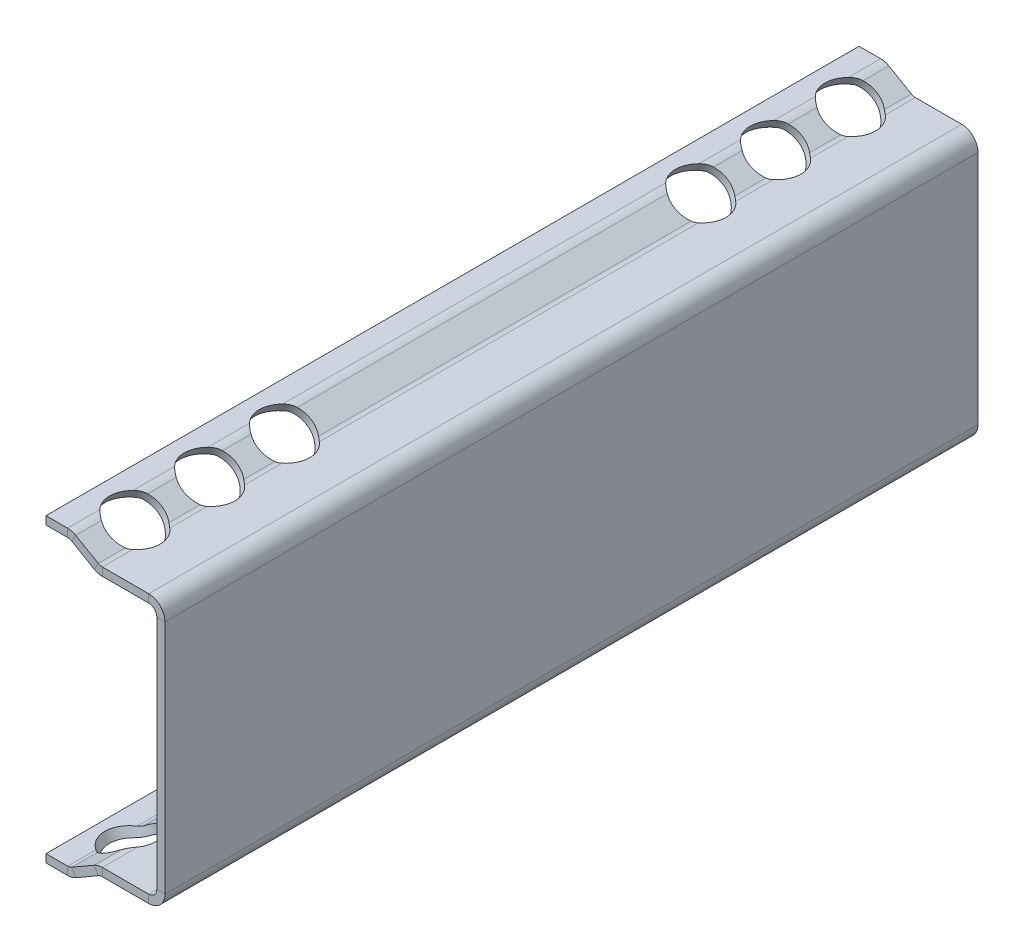
from build123d import *

# Parameters (mm, degrees)
ODGI_CIE_BAZOWE1_DEPTH     = 50
SZKIC6_R                   = 1.6
WYTNIJ_WYCI_GNI_CIE1_DEPTH = 54.108628745


# Sheet-metal steps are written as plain solids
with BuildPart() as part:
    # Szkic1 → Odgięcie bazowe1 (new body)
    with BuildSketch(Plane.XY):
        with BuildLine():
            Line((-7.315765601, -9.25), (-5.983974596, -9.25))
            ThreePointArc((-5.983974596, -9.25), (-5.725155551, -9.215925826), (-5.483974596, -9.116025404))
            Line((-5.483974596, -9.116025404), (-4.1, -8.316987298))
            ThreePointArc((-4.1, -8.316987298), (-3.979409523, -8.267037087), (-3.85, -8.25))
            Line((-3.85, -8.25), (-1, -8.25))
            ThreePointArc((-1, -8.25), (-0.292893219, -7.957106781), (0, -7.25))
            Line((0, -7.25), (0, 7.25))
            ThreePointArc((0, 7.25), (-0.292893219, 7.957106781), (-1, 8.25))
            Line((-1, 8.25), (-3.85, 8.25))
            ThreePointArc((-3.85, 8.25), (-3.979409523, 8.267037087), (-4.1, 8.316987298))
            Line((-4.1, 8.316987298), (-5.483974596, 9.116025404))
            ThreePointArc((-5.483974596, 9.116025404), (-5.725155551, 9.215925826), (-5.983974596, 9.25))
            Line((-5.983974596, 9.25), (-7.315765601, 9.25))
            Line((-7.315765601, 9.25), (-7.315765601, 8.75))
            Line((-7.315765601, 8.75), (-5.983974596, 8.75))
            ThreePointArc((-5.983974596, 8.75), (-5.854565074, 8.732962913), (-5.733974596, 8.683012702))
            Line((-5.733974596, 8.683012702), (-4.35, 7.883974596))
            ThreePointArc((-4.35, 7.883974596), (-4.108819045, 7.784074174), (-3.85, 7.75))
            Line((-3.85, 7.75), (-1, 7.75))
            ThreePointArc((-1, 7.75), (-0.646446609, 7.603553391), (-0.5, 7.25))
            Line((-0.5, 7.25), (-0.5, -7.25))
            ThreePointArc((-0.5, -7.25), (-0.646446609, -7.603553391), (-1, -7.75))
            Line((-1, -7.75), (-3.85, -7.75))
            ThreePointArc((-3.85, -7.75), (-4.108819045, -7.784074174), (-4.35, -7.883974596))
            Line((-4.35, -7.883974596), (-5.733974596, -8.683012702))
            ThreePointArc((-5.733974596, -8.683012702), (-5.854565074, -8.732962913), (-5.983974596, -8.75))
            Line((-5.983974596, -8.75), (-7.315765601, -8.75))
            Line((-7.315765601, -8.75), (-7.315765601, -9.25))
        make_face()
    extrude(amount=-ODGI_CIE_BAZOWE1_DEPTH)

    # Szkic6 → Wytnij-wyciągnięcie1 (cut, through all)
    with BuildSketch(Plane(origin=(3.076361142, 5.3284138, 0), x_dir=(0.8660254037844378, -0.5000000000000017, 0), z_dir=(0.5000000000000016, 0.8660254037844377, 0))):
        with Locations(Location((-8.575223208, 3, 0), (0, 0, 117.227950477))):
            Circle(SZKIC6_R)
        with Locations(Location((-8.575223208, 7.6, 0), (0, 0, 117.227950477))):
            Circle(SZKIC6_R)
        with Locations(Location((-8.575223208, 12.2, 0), (0, 0, 242.772049523))):
            Circle(SZKIC6_R)
        with Locations(Location((-8.575223208, 37.8, 0), (0, 0, 242.772049523))):
            Circle(SZKIC6_R)
        with Locations(Location((-8.575223208, 42.4, 0), (0, 0, 242.772049523))):
            Circle(SZKIC6_R)
        with Locations(Location((-8.575223208, 47, 0), (0, 0, 242.772049523))):
            Circle(SZKIC6_R)
    wytnij_wyci_gni_cie1 = extrude(amount=-WYTNIJ_WYCI_GNI_CIE1_DEPTH, mode=Mode.SUBTRACT)

    # Lustro1: Wytnij-wyciągnięcie1 across plane
    add(wytnij_wyci_gni_cie1.mirror(Plane(origin=(0, 0, 0), x_dir=(0, 0, 1), z_dir=(0, -1, 0))), mode=Mode.SUBTRACT)


solid = part.part
